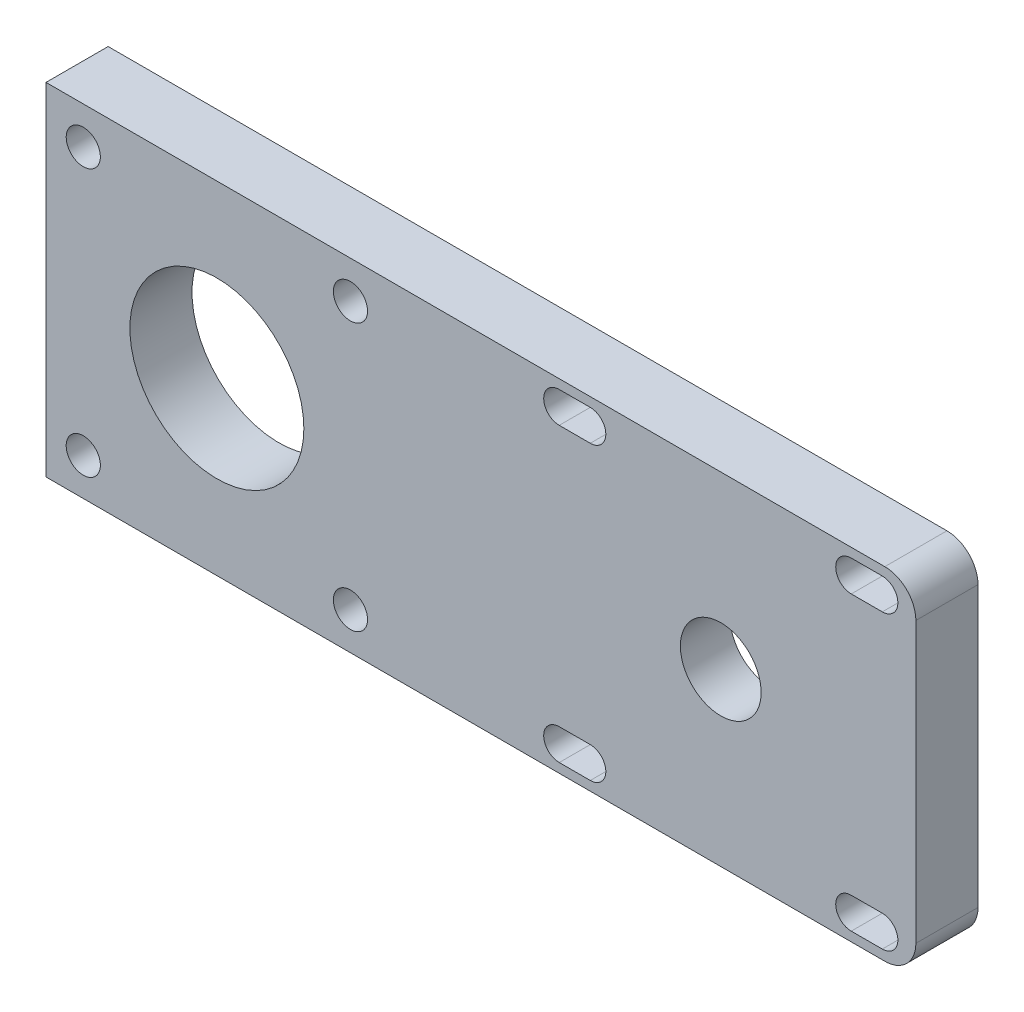
from build123d import *

# Parameters (mm, degrees)
SCHIZZO1_W                   = 140
SCHIZZO1_H                   = 55
ESTRUSIONE_ESTRUSIONE1_DEPTH = 10
SCHIZZO2_R                   = 14
SCHIZZO2_R_2                 = 2.75
TAGLIO_ESTRUSIONE1_DEPTH     = 151.748134317
RACCORDO1_R                  = 5
SCHIZZO3_R                   = 6.5
TAGLIO_ESTRUSIONE2_DEPTH     = 151.748134317
TAGLIO_ESTRUSIONE3_DEPTH     = 2


with BuildPart() as part:
    # Schizzo1 → Estrusione-Estrusione1 (new body)
    with BuildSketch(Plane.XY):
        with Locations((70, 27.5)):
            Rectangle(SCHIZZO1_W, SCHIZZO1_H)
    extrude(amount=-ESTRUSIONE_ESTRUSIONE1_DEPTH)

    # Schizzo2 → Taglio-Estrusione1 (cut, through all)
    with BuildSketch(Plane.XY):
        with Locations((27.5, 27.5)):
            Circle(SCHIZZO2_R)
        with Locations((6, 6)):
            Circle(SCHIZZO2_R_2)
        with Locations((49, 6)):
            Circle(SCHIZZO2_R_2)
        with Locations((49, 49)):
            Circle(SCHIZZO2_R_2)
        with Locations((6, 49)):
            Circle(SCHIZZO2_R_2)
    extrude(amount=-TAGLIO_ESTRUSIONE1_DEPTH, mode=Mode.SUBTRACT)

    # Raccordo1
    raccordo1_edges = [part.edges().sort_by_distance(p)[0] for p in [
        (140, 0, -5),
        (140, 55, -5),
    ]]
    fillet(raccordo1_edges, radius=RACCORDO1_R)

    # Schizzo3 → Taglio-Estrusione2 (cut, through all)
    with BuildSketch(Plane(origin=(0, 0, -10), x_dir=(-1, 0, 0), z_dir=(0, 0, -1))):
        with Locations((-108.6, 27.5)):
            Circle(SCHIZZO3_R)
        with BuildLine():
            Line((-134.6, 53.5), (-129.6, 53.5))
            ThreePointArc((-129.6, 53.5), (-127.1, 51), (-129.6, 48.5))
            Line((-129.6, 48.5), (-134.6, 48.5))
            ThreePointArc((-134.6, 48.5), (-137.1, 51), (-134.6, 53.5))
        make_face()
        with BuildLine():
            Line((-82.6, 53.5), (-87.6, 53.5))
            ThreePointArc((-87.6, 53.5), (-90.1, 51), (-87.6, 48.5))
            Line((-87.6, 48.5), (-82.6, 48.5))
            ThreePointArc((-82.6, 48.5), (-80.1, 51), (-82.6, 53.5))
        make_face()
        with BuildLine():
            Line((-134.6, 1.5), (-129.6, 1.5))
            ThreePointArc((-129.6, 1.5), (-127.1, 4), (-129.6, 6.5))
            Line((-129.6, 6.5), (-134.6, 6.5))
            ThreePointArc((-134.6, 6.5), (-137.1, 4), (-134.6, 1.5))
        make_face()
        with BuildLine():
            Line((-82.6, 1.5), (-87.6, 1.5))
            ThreePointArc((-87.6, 1.5), (-90.1, 4), (-87.6, 6.5))
            Line((-87.6, 6.5), (-82.6, 6.5))
            ThreePointArc((-82.6, 6.5), (-80.1, 4), (-82.6, 1.5))
        make_face()
    extrude(amount=-TAGLIO_ESTRUSIONE2_DEPTH, mode=Mode.SUBTRACT)

    # Schizzo4 → Taglio-Estrusione3 (cut)
    with BuildSketch(Plane(origin=(0, 0, -10), x_dir=(-1, 0, 0), z_dir=(0, 0, -1))):
        with BuildLine():
            Line((-88.6, 9), (-128.6, 9))
            ThreePointArc((-128.6, 9), (-132.135533906, 10.464466094), (-133.6, 14))
            Line((-133.6, 14), (-133.6, 41))
            ThreePointArc((-133.6, 41), (-132.135533906, 44.535533906), (-128.6, 46))
            Line((-128.6, 46), (-88.6, 46))
            ThreePointArc((-88.6, 46), (-85.064466094, 44.535533906), (-83.6, 41))
            Line((-83.6, 41), (-83.6, 14))
            ThreePointArc((-83.6, 14), (-85.064466094, 10.464466094), (-88.6, 9))
        make_face()
    extrude(amount=-TAGLIO_ESTRUSIONE3_DEPTH, mode=Mode.SUBTRACT)


solid = part.part
